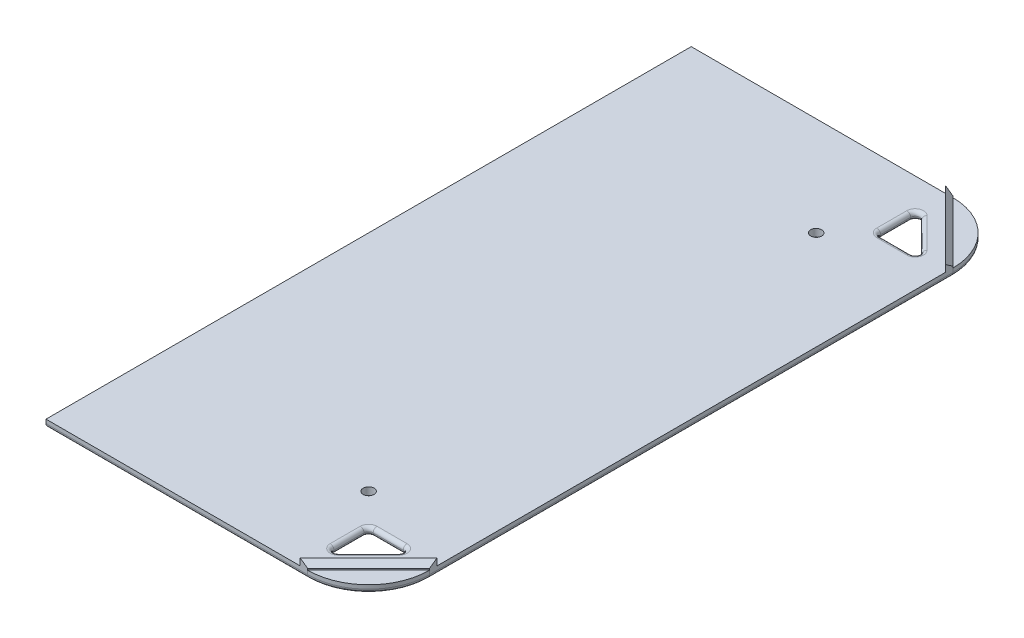
from build123d import *

# Parameters (mm, degrees)
SKETCH1_W           = 134.62
SKETCH1_H           = 269.24
BOSS_EXTRUDE1_DEPTH = 3.175
BOSS_EXTRUDE2_DEPTH = 3.175
CUT_EXTRUDE1_REACH  = 192.408
SKETCH2_3_R         = 2.286
CHAMFER1_SIZE       = 2.54
FILLET1_R           = 1.905
FILLET2_R           = 1.5875
FILLET3_R           = 25.4
FILLET4_R           = 1.5875
SKETCH3_W           = 31.75
SKETCH3_H           = 57.15
BOSS_EXTRUDE3_DEPTH = 3.175
SKETCH4_W           = 50.8
SKETCH4_H           = 3.175
CUT_EXTRUDE2_DEPTH  = 19.05
FILLET5_R           = 12.7
FILLET6_R           = 3.175


# Some blends are built 0.0001 mm under size
with BuildPart() as part:
    # Sketch1 → Boss-Extrude1 (new body)
    with BuildSketch(Plane(origin=(0, 0, 0), x_dir=(1, 0, 0), z_dir=(0, 1, 0))):
        with Locations((67.31, 0)):
            Rectangle(SKETCH1_W, SKETCH1_H)
    extrude(amount=BOSS_EXTRUDE1_DEPTH)

    # Sketch2 → Boss-Extrude2 (add)
    with BuildSketch(Plane(origin=(0, 3.175, 0), x_dir=(1, 0, 0), z_dir=(0, 1, 0))):
        Polygon((134.62, 109.22), (109.22, 134.62), (106.045, 134.62), (120.3325, 120.3325), (134.62, 106.045), align=None)
        Polygon((134.62, -109.22), (134.62, -106.045), (120.3325, -120.3325), (106.045, -134.62), (109.22, -134.62), align=None)
    extrude(amount=BOSS_EXTRUDE2_DEPTH)

    # Sketch2<3> → Cut-Extrude1 (cut, up to next)
    with BuildSketch(Plane(origin=(0, 3.175, 0), x_dir=(1, 0, 0), z_dir=(0, 1, 0)), mode=Mode.PRIVATE) as cut_extrude1_sk1:
        with Locations(Location((93.391731637, -93.391731637, 0), (0, 0, 270))):
            Circle(SKETCH2_3_R)
    cut_extrude1_tool1 = extrude(cut_extrude1_sk1.sketch, amount=-CUT_EXTRUDE1_REACH, mode=Mode.PRIVATE) & part.part
    # Sketch2<3> → Cut-Extrude1 (cut, up to next)
    with BuildSketch(Plane(origin=(0, 3.175, 0), x_dir=(1, 0, 0), z_dir=(0, 1, 0)), mode=Mode.PRIVATE) as cut_extrude1_sk2:
        with Locations(Location((93.391731637, 93.391731637, 0), (0, 0, 270))):
            Circle(SKETCH2_3_R)
    cut_extrude1_tool2 = extrude(cut_extrude1_sk2.sketch, amount=-CUT_EXTRUDE1_REACH, mode=Mode.PRIVATE) & part.part
    # Sketch2<3> → Cut-Extrude1 (cut, up to next)
    with BuildSketch(Plane(origin=(0, 3.175, 0), x_dir=(1, 0, 0), z_dir=(0, 1, 0)), mode=Mode.PRIVATE) as cut_extrude1_sk3:
        Polygon((105.868359133, -124.918359133), (124.918359133, -105.868359133), (105.868359133, -105.868359133), align=None)
    cut_extrude1_tool3 = extrude(cut_extrude1_sk3.sketch, amount=-CUT_EXTRUDE1_REACH, mode=Mode.PRIVATE) & part.part
    # Sketch2<3> → Cut-Extrude1 (cut, up to next)
    with BuildSketch(Plane(origin=(0, 3.175, 0), x_dir=(1, 0, 0), z_dir=(0, 1, 0)), mode=Mode.PRIVATE) as cut_extrude1_sk4:
        Polygon((124.918359133, 105.868359133), (105.868359133, 124.918359133), (105.868359133, 105.868359133), align=None)
    cut_extrude1_tool4 = extrude(cut_extrude1_sk4.sketch, amount=-CUT_EXTRUDE1_REACH, mode=Mode.PRIVATE) & part.part
    add(cut_extrude1_tool1.solids().sort_by_distance((93.391732, 3.175, 93.391732))[0], mode=Mode.SUBTRACT)
    add(cut_extrude1_tool2.solids().sort_by_distance((93.391732, 3.175, -93.391732))[0], mode=Mode.SUBTRACT)
    add(cut_extrude1_tool3.solids().sort_by_distance((112.218359, 3.175, 112.218359))[0], mode=Mode.SUBTRACT)
    add(cut_extrude1_tool4.solids().sort_by_distance((112.218359, 3.175, -112.218359))[0], mode=Mode.SUBTRACT)

    # Chamfer1
    # the kernel refuses this chamfer: 2.54 mm, written as the material it takes off along each edge
    with BuildSketch(Plane(origin=(104.601125621, 6.35, 139.238874379), x_dir=(0.019442520806015235, -0.9996219169112966, 0.019442520806015006), z_dir=(0.7071067811865434, 0, -0.7071067811865517)), Plane(origin=(139.238874379, 6.35, -104.601125621), x_dir=(0.019442520806015124, -0.9996219169112966, -0.019442520806015124), z_dir=(-0.7071067811865476, 0, -0.7071067811865476))) as chamfer1_piece_1:
        Polygon((CHAMFER1_SIZE * 0.999621916911, CHAMFER1_SIZE * 0.0274958766106), (-CHAMFER1_SIZE * 0.0274958766106, CHAMFER1_SIZE * 0.999621916911), (0, 0), align=None)
    extrude(amount=48.985174063, mode=Mode.SUBTRACT)

    # Fillet1
    fillet1_edges = [part.edges().sort_by_distance(p)[0] for p in [
        (105.868359133, 1.5875, -124.918359133),
        (124.918359133, 1.5875, -105.868359133),
        (105.868359133, 1.5875, -105.868359133),
        (105.868359133, 1.5875, 105.868359133),
        (124.918359133, 1.5875, 105.868359133),
        (105.868359133, 1.5875, 124.918359133),
    ]]
    fillet(fillet1_edges, radius=FILLET1_R)

    # Fillet2
    fillet2_edges = [part.edges().sort_by_distance(p)[0] for p in [
        (107.044347195, 3.175, 122.079272807),
        (105.868359133, 3.175, 114.046320715),
        (106.426320715, 3.175, 106.426320715),
        (114.046320715, 3.175, 105.868359133),
        (122.079272807, 3.175, 107.044347195),
        (122.079272807, 0, 107.044347195),
        (114.046320715, 0, 105.868359133),
        (106.426320715, 0, 106.426320715),
        (105.868359133, 0, 114.046320715),
        (107.044347195, 0, 122.079272807),
        (122.079272807, 3.175, -107.044347195),
        (114.046320715, 3.175, -105.868359133),
        (106.426320715, 3.175, -106.426320715),
        (105.868359133, 3.175, -114.046320715),
        (107.044347195, 3.175, -122.079272807),
        (107.044347195, 0, -122.079272807),
        (105.868359133, 0, -114.046320715),
        (106.426320715, 0, -106.426320715),
        (114.046320715, 0, -105.868359133),
        (122.079272807, 0, -107.044347195),
        (115.393359133, 3.175, 115.393359133),
        (115.393359133, 0, 115.393359133),
        (115.393359133, 3.175, -115.393359133),
        (115.393359133, 0, -115.393359133),
    ]]
    fillet(fillet2_edges, radius=FILLET2_R - 0.0001)  # a hair under: the kernel refuses the full size

    # Fillet3
    fillet3_edges = [part.edges().sort_by_distance(p)[0] for p in [
        (134.62, 1.5875, -134.62),
        (134.62, 1.5875, 134.62),
    ]]
    fillet(fillet3_edges, radius=FILLET3_R)

    # Fillet4
    fillet4_edges = [part.edges().sort_by_distance(p)[0] for p in [
        (134.62, 0, 0),
        (127.180512242, 0, 127.180512242),
        (127.180512242, 0, -127.180512242),
        (54.61, 0, -134.62),
        (54.61, 0, 134.62),
    ]]
    fillet(fillet4_edges, radius=FILLET4_R)

    # Sketch3 → Boss-Extrude3 (add)
    with BuildSketch(Plane.XZ):
        with Locations((15.875, 82.2325)):
            Rectangle(SKETCH3_W, SKETCH3_H)
        with Locations((15.875, 0)):
            Rectangle(SKETCH3_W, SKETCH3_H)
        with Locations((15.875, -82.2325)):
            Rectangle(SKETCH3_W, SKETCH3_H)
    extrude(amount=BOSS_EXTRUDE3_DEPTH)

    # Sketch4 → Cut-Extrude2 (cut)
    with BuildSketch(Plane.ZY):
        Rectangle(SKETCH4_W, SKETCH4_H)
        with Locations((82.2325, 0)):
            Rectangle(SKETCH4_W, SKETCH4_H)
        with Locations((-82.2325, 0)):
            Rectangle(SKETCH4_W, SKETCH4_H)
    extrude(amount=-CUT_EXTRUDE2_DEPTH, mode=Mode.SUBTRACT)

    # Fillet5
    fillet5_edges = [part.edges().sort_by_distance(p)[0] for p in [
        (31.75, -1.5875, 53.6575),
        (31.75, -1.5875, 110.8075),
        (31.75, -1.5875, -28.575),
        (31.75, -1.5875, 28.575),
        (31.75, -1.5875, -110.8075),
        (31.75, -1.5875, -53.6575),
    ]]
    fillet(fillet5_edges, radius=FILLET5_R)

    # Fillet6
    fillet6_edges = [part.edges().sort_by_distance(p)[0] for p in [
        (9.525, -3.175, -110.8075),
        (28.030256121, -3.175, -107.087756121),
        (31.75, -3.175, -82.2325),
        (28.030256121, -3.175, -57.377243879),
        (9.525, -3.175, -28.575),
        (28.030256121, -3.175, -24.855256121),
        (31.75, -3.175, 0),
        (28.030256121, -3.175, 24.855256121),
        (9.525, -3.175, 53.6575),
        (28.030256121, -3.175, 57.377243879),
        (31.75, -3.175, 82.2325),
        (28.030256121, -3.175, 107.087756121),
        (9.525, -3.175, -53.6575),
        (9.525, -3.175, 28.575),
        (9.525, -3.175, 110.8075),
    ]]
    fillet(fillet6_edges, radius=FILLET6_R - 0.0001)  # a hair under: the kernel refuses the full size


solid = part.part
